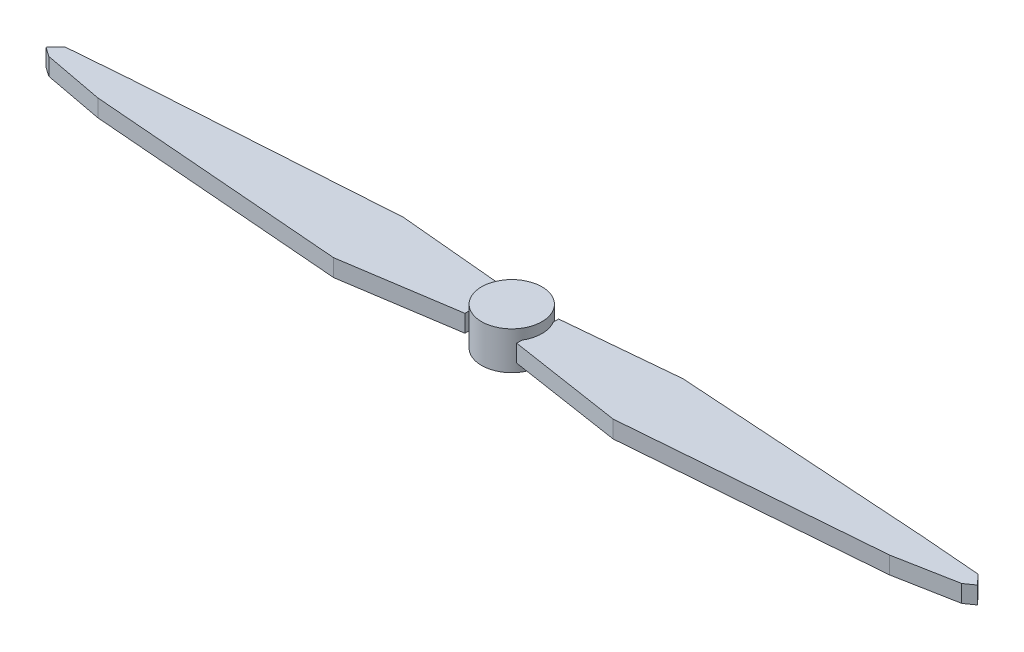
from build123d import *

# Parameters (mm, degrees)
BOSS_EXTRUDE1_DEPTH   = 4
BOSS_EXTRUDE1_2_DEPTH = 4
SKETCH2_R             = 14
BOSS_EXTRUDE2_DEPTH   = 8.8


with BuildPart() as part:
    # Sketch1 → Boss-Extrude1 (new, symmetric)
    with BuildSketch(Plane(origin=(0, 0, 0), x_dir=(1, 0, 0), z_dir=(0, 1, 0))):
        Polygon((12, -9.7155), (64.77, -17.81175), (183.515, -8.31215), (211.582, -3.0226), (215.9, 0), (211.582, 4.5339), (183.515, 6.80085), (64.77, 14.57325), (12, 9.7155), align=None)
    extrude(amount=BOSS_EXTRUDE1_DEPTH, both=True)



with BuildPart() as body_2:
    # Sketch1 → Boss-Extrude1 2 (new, symmetric)
    with BuildSketch(Plane(origin=(0, 0, 0), x_dir=(1, 0, 0), z_dir=(0, 1, 0))):
        Polygon((-12, -9.7155), (-64.77, -17.81175), (-183.515, -8.31215), (-211.582, -3.0226), (-215.9, 0), (-211.582, 4.5339), (-183.515, 6.80085), (-64.77, 14.57325), (-12, 9.7155), align=None)
    extrude(amount=BOSS_EXTRUDE1_2_DEPTH, both=True)


with BuildPart() as part_1:
    add(part.part)

    add(body_2.part)  # Boss-Extrude2 merges body 2
    # Sketch2 → Boss-Extrude2 (add, symmetric)
    with BuildSketch(Plane(origin=(0, 0, 0), x_dir=(1, 0, 0), z_dir=(0, 1, 0))):
        Circle(SKETCH2_R)
    extrude(amount=BOSS_EXTRUDE2_DEPTH, both=True)


solid = part_1.part
